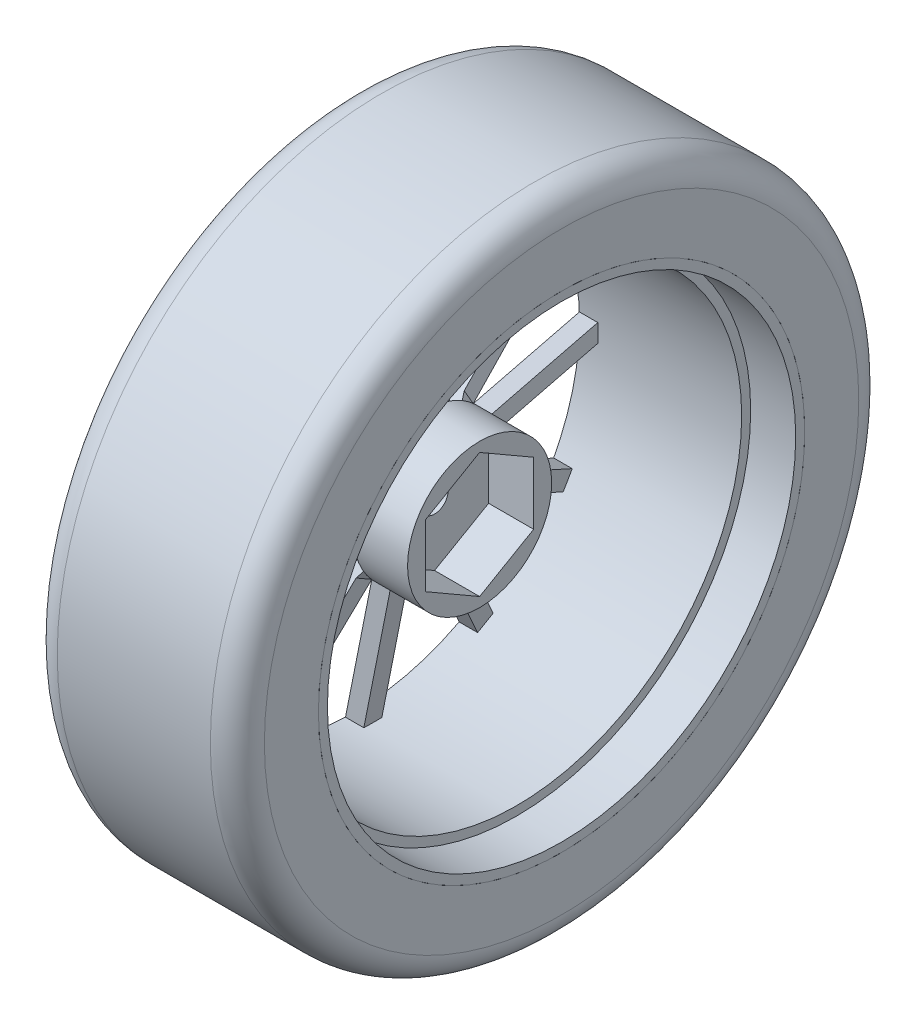
from build123d import *
from build123d.topology import SkipClean

# Parameters (mm, degrees)
SKETCH1_R            = 8
BOSS_EXTRUDE1_DEPTH  = 5
SKETCH2_R            = 8
BOSS_EXTRUDE2_DEPTH  = 1
SKETCH3_R            = 1.5
CUT_EXTRUDE1_DEPTH   = 3
BOSS_EXTRUDE3_DEPTH  = 1
SKETCH5_R            = 1.5
CUT_EXTRUDE2_DEPTH   = 50
CIRPATTERN3_COUNT    = 12
SKETCH12_R           = 27
SKETCH12_R_2         = 25
BOSS_EXTRUDE5_DEPTH  = 2
SKETCH14_R           = 27
SKETCH14_R_2         = 25
BOSS_EXTRUDE7_DEPTH  = 3
SKETCH15_R           = 26
SKETCH15_R_2         = 25
BOSS_EXTRUDE8_DEPTH  = 15
SKETCH16_R           = 27
SKETCH16_R_2         = 26
BOSS_EXTRUDE9_DEPTH  = 5
SKETCH17_R           = 36
SKETCH17_R_2         = 27
BOSS_EXTRUDE10_DEPTH = 23
FILLET3_R            = 3


with BuildPart() as part:
    # Sketch1 → Boss-Extrude1 (new body)
    with BuildSketch(Plane(origin=(0, 0, 0), x_dir=(0, 0, -1), z_dir=(1, 0, 0))):
        Circle(SKETCH1_R)
        Polygon((0, 6.92820323), (-6, 3.464101615), (-6, -3.464101615), (0, -6.92820323), (6, -3.464101615), (6, 3.464101615), align=None, mode=Mode.SUBTRACT)
    extrude(amount=BOSS_EXTRUDE1_DEPTH)



with BuildPart() as body_2:
    # Sketch2 → Boss-Extrude2 (new body)
    with BuildSketch(Plane.ZY):
        Circle(SKETCH2_R)
    extrude(amount=BOSS_EXTRUDE2_DEPTH)

    # Sketch3 → Cut-Extrude1 (cut)
    with BuildSketch(Plane.ZY.offset(1)):
        Circle(SKETCH3_R)
    extrude(amount=-CUT_EXTRUDE1_DEPTH, mode=Mode.SUBTRACT)


with BuildPart() as body_3:
    # Sketch4 → Boss-Extrude3 (new, symmetric)
    with BuildSketch(Plane(origin=(0, 0, 0), x_dir=(1, 0, 0), z_dir=(0, 1, 0))):
        Polygon((-5.481210349, 7.805046689), (-1, 0), (-1, 4.016771943), (-3.583486264, 8.516500664), (-6.859244832, 25), (-8.898355852, 25), align=None)
    extrude(amount=BOSS_EXTRUDE3_DEPTH, both=True)

    # Sketch5 → Cut-Extrude2 (cut)
    with BuildSketch(Plane(origin=(0, 0, 0), x_dir=(0, 0, -1), z_dir=(1, 0, 0))):
        Circle(SKETCH5_R)
    extrude(amount=-CUT_EXTRUDE2_DEPTH, mode=Mode.SUBTRACT)


with BuildPart() as cirpattern3_1:
    # CirPattern3: pattern copy
    add(body_3.part.rotate(Axis((-1, 0, 0), (-1, 0, 0)), 1 * 360 / CIRPATTERN3_COUNT))


with BuildPart() as cirpattern3_2:
    # CirPattern3: pattern copy
    add(body_3.part.rotate(Axis((-1, 0, 0), (-1, 0, 0)), 2 * 360 / CIRPATTERN3_COUNT))


with BuildPart() as cirpattern3_3:
    # CirPattern3: pattern copy
    add(body_3.part.rotate(Axis((-1, 0, 0), (-1, 0, 0)), 3 * 360 / CIRPATTERN3_COUNT))


with BuildPart() as cirpattern3_4:
    # CirPattern3: pattern copy
    add(body_3.part.rotate(Axis((-1, 0, 0), (-1, 0, 0)), 4 * 360 / CIRPATTERN3_COUNT))


with BuildPart() as cirpattern3_5:
    # CirPattern3: pattern copy
    add(body_3.part.rotate(Axis((-1, 0, 0), (-1, 0, 0)), 5 * 360 / CIRPATTERN3_COUNT))


with BuildPart() as cirpattern3_6:
    # CirPattern3: pattern copy
    add(body_3.part.rotate(Axis((-1, 0, 0), (-1, 0, 0)), 6 * 360 / CIRPATTERN3_COUNT))


with BuildPart() as cirpattern3_7:
    # CirPattern3: pattern copy
    add(body_3.part.rotate(Axis((-1, 0, 0), (-1, 0, 0)), 7 * 360 / CIRPATTERN3_COUNT))


with BuildPart() as cirpattern3_8:
    # CirPattern3: pattern copy
    add(body_3.part.rotate(Axis((-1, 0, 0), (-1, 0, 0)), 8 * 360 / CIRPATTERN3_COUNT))


with BuildPart() as cirpattern3_9:
    # CirPattern3: pattern copy
    add(body_3.part.rotate(Axis((-1, 0, 0), (-1, 0, 0)), 9 * 360 / CIRPATTERN3_COUNT))


with BuildPart() as cirpattern3_10:
    # CirPattern3: pattern copy
    add(body_3.part.rotate(Axis((-1, 0, 0), (-1, 0, 0)), 10 * 360 / CIRPATTERN3_COUNT))


with BuildPart() as cirpattern3_11:
    # CirPattern3: pattern copy
    add(body_3.part.rotate(Axis((-1, 0, 0), (-1, 0, 0)), 11 * 360 / CIRPATTERN3_COUNT))


with BuildPart() as body_3_1:
    add(body_3.part)

    add(cirpattern3_1.part)  # Boss-Extrude5 merges CirPattern3_1

    add(cirpattern3_2.part)  # Boss-Extrude5 merges CirPattern3_2

    add(cirpattern3_3.part)  # Boss-Extrude5 merges CirPattern3_3

    add(cirpattern3_4.part)  # Boss-Extrude5 merges CirPattern3_4

    add(cirpattern3_5.part)  # Boss-Extrude5 merges CirPattern3_5

    add(cirpattern3_6.part)  # Boss-Extrude5 merges CirPattern3_6

    add(cirpattern3_7.part)  # Boss-Extrude5 merges CirPattern3_7

    add(cirpattern3_8.part)  # Boss-Extrude5 merges CirPattern3_8

    add(cirpattern3_9.part)  # Boss-Extrude5 merges CirPattern3_9

    add(cirpattern3_10.part)  # Boss-Extrude5 merges CirPattern3_10

    add(cirpattern3_11.part)  # Boss-Extrude5 merges CirPattern3_11
    # Sketch12 → Boss-Extrude5 (add)
    with BuildSketch(Plane(origin=(-8.9, 0, 0), x_dir=(0, 0, -1), z_dir=(1, 0, 0))):
        Circle(SKETCH12_R)
        Circle(SKETCH12_R_2, mode=Mode.SUBTRACT)
    extrude(amount=BOSS_EXTRUDE5_DEPTH)

    # Sketch14 → Boss-Extrude7 (add)
    with SkipClean():  # the faces are left unmerged after this step: merging them gives an invalid solid
        with BuildSketch(Plane.ZY.offset(8.9)):
            Circle(SKETCH14_R)
            Circle(SKETCH14_R_2, mode=Mode.SUBTRACT)
        extrude(amount=-BOSS_EXTRUDE7_DEPTH)


with BuildPart() as part_1:
    with SkipClean():  # the faces are left unmerged after this step: merging them gives an invalid solid
        add(part.part)

        add(body_2.part)  # Boss-Extrude8 merges body 2

        add(body_3_1.part)  # Boss-Extrude8 merges body 3
        # Sketch15 → Boss-Extrude8 (add)
        with BuildSketch(Plane(origin=(-5.9, 0, 0), x_dir=(0, 0, -1), z_dir=(1, 0, 0))):
            Circle(SKETCH15_R)
            Circle(SKETCH15_R_2, mode=Mode.SUBTRACT)
        extrude(amount=BOSS_EXTRUDE8_DEPTH)


with BuildPart() as body_2_2:
    # Sketch16 → Boss-Extrude9 (new body)
    with BuildSketch(Plane(origin=(9.1, 0, 0), x_dir=(0, 0, -1), z_dir=(1, 0, 0))):
        Circle(SKETCH16_R)
        Circle(SKETCH16_R_2, mode=Mode.SUBTRACT)
    extrude(amount=BOSS_EXTRUDE9_DEPTH)


with BuildPart() as body_3_2:
    # Sketch17 → Boss-Extrude10 (new body)
    with BuildSketch(Plane.ZY.offset(8.9)):
        Circle(SKETCH17_R)
        Circle(SKETCH17_R_2, mode=Mode.SUBTRACT)
    extrude(amount=-BOSS_EXTRUDE10_DEPTH)

    # Fillet3
    fillet3_edges = [body_3_2.edges().sort_by_distance(p)[0] for p in [
        (14.1, 0, -36),
        (-8.9, 0, -36),
    ]]
    fillet(fillet3_edges, radius=FILLET3_R)


solid = Compound([part_1.part, body_2_2.part, body_3_2.part])
